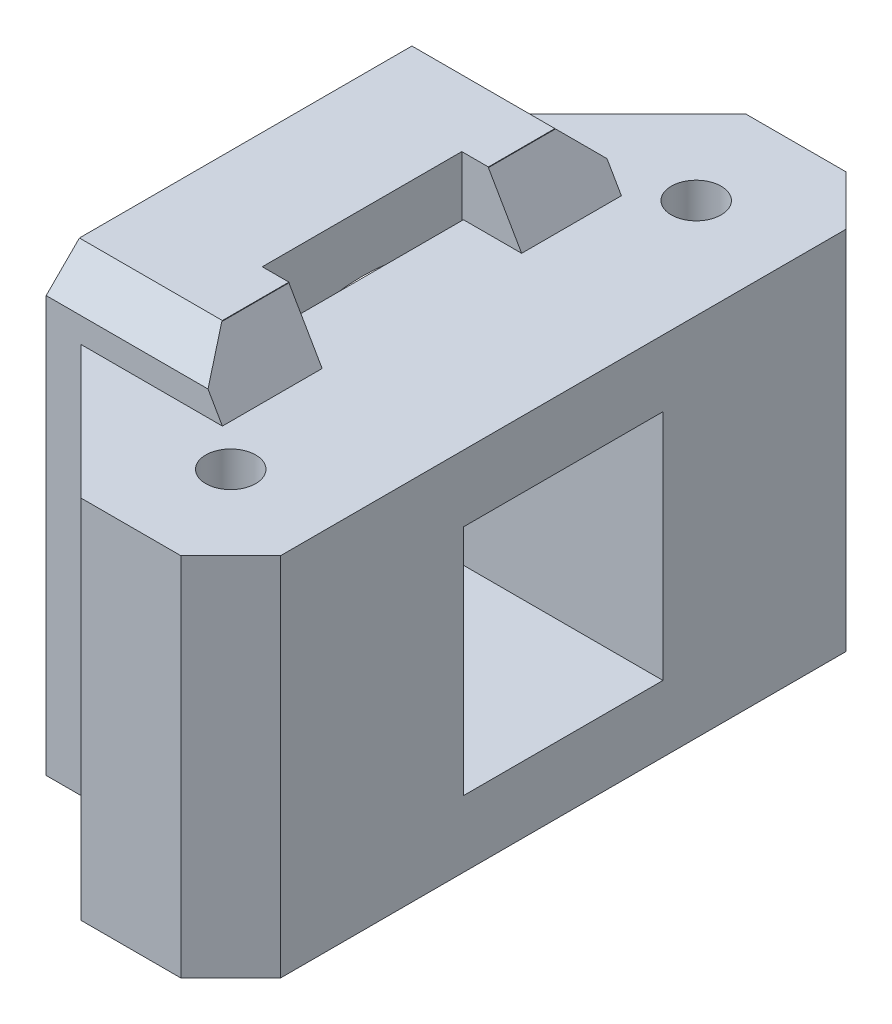
from build123d import *

# Parameters (mm, degrees)
SKETCH1_R                 = 1.5
BOSS_EXTRUDE1_DEPTH       = 3
BOSS_EXTRUDE2_START       = 22.5
SKETCH2_W                 = 1.6
SKETCH2_H                 = 6
BOSS_EXTRUDE2_DEPTH       = 29
SKETCH4_R                 = 1.5
BOSS_EXTRUDE5_DEPTH       = 1
CHAMFER2_SIZE             = 2
CHAMFER2_SIZE2            = 3.464101615
SKETCH3_W                 = 24
SKETCH3_H                 = 29
SKETCH3_R                 = 11
BOSS_EXTRUDE4_DEPTH       = 7
CHAMFER3_SIZE             = 2
CHAMFER2_OF_MIRROR1_SIZE2 = 2
CHAMFER2_OF_MIRROR1_SIZE  = 3.464101615
SKETCH5_R                 = 2
BOSS_EXTRUDE6_DEPTH       = 14
CHAMFER5_SIZE             = 5


with BuildPart() as part:
    # Sketch1 → Boss-Extrude1 (new body)
    with BuildSketch(Plane(origin=(0, 0, 0), x_dir=(1, 0, 0), z_dir=(0, 1, 0))):
        Polygon((-6, 17), (-3, 20), (3, 20), (6, 17), (6, -17), (3, -20), (-3, -20), (-6, -17), align=None)
        with Locations(Location((0, 14, 0), (0, 0, 270))):
            Circle(SKETCH1_R, mode=Mode.SUBTRACT)
        with Locations(Location((0, -14, 0), (0, 0, 270))):
            Circle(SKETCH1_R, mode=Mode.SUBTRACT)
    boss_extrude1 = extrude(amount=BOSS_EXTRUDE1_DEPTH)

    # Sketch2 → Boss-Extrude2 (add)
    with BuildSketch(Plane(origin=(0, 3, 0), x_dir=(1, 0, 0), z_dir=(0, 1, 0)).offset(BOSS_EXTRUDE2_START)):
        with Locations((-5.3, 9)):
            Rectangle(SKETCH2_W, SKETCH2_H)
        with Locations((-5.3, -9)):
            Rectangle(SKETCH2_W, SKETCH2_H)
    extrude(amount=-BOSS_EXTRUDE2_DEPTH)

    # Sketch4 → Boss-Extrude5 (add)
    with BuildSketch(Plane(origin=(0, 3, 0), x_dir=(1, 0, 0), z_dir=(0, 1, 0))):
        Polygon((-3, 20), (-6, 17), (-6, 12), (-4.5, 12), (-4.5, 6), (-6, 6), (-6, -6), (-4.5, -6), (-4.5, -12), (-6, -12), (-6, -17), (-3, -20), (3, -20), (6, -17), (6, 17), (3, 20), align=None)
        with Locations(Location((0, 14, 0), (0, 0, 270))):
            Circle(SKETCH4_R, mode=Mode.SUBTRACT)
        with Locations(Location((0, -14, 0), (0, 0, 270))):
            Circle(SKETCH4_R, mode=Mode.SUBTRACT)
    boss_extrude5 = extrude(amount=BOSS_EXTRUDE5_DEPTH)

    # Chamfer2
    chamfer2_edges = [part.edges().sort_by_distance(p)[0] for p in [
        (-4.5, 0, 9),
        (-4.5, 0, -9),
    ]]
    chamfer2_side = [part.faces().sort_by_distance(p)[0] for p in [
        (0.219837568, 0, 0),
    ]]
    chamfer(chamfer2_edges, length=CHAMFER2_SIZE, length2=CHAMFER2_SIZE2, reference=chamfer2_side[0])

    # Sketch3 → Boss-Extrude4 (add)
    with BuildSketch(Plane.ZY.offset(6.1)):
        with Locations((0, 11)):
            Rectangle(SKETCH3_W, SKETCH3_H)
        with Locations(Location((0, 11, 0), (0, 0, 236.944268849))):
            Circle(SKETCH3_R, mode=Mode.SUBTRACT)
    extrude(amount=BOSS_EXTRUDE4_DEPTH)

    # Chamfer3
    chamfer3_edges = [part.edges().sort_by_distance(p)[0] for p in [
        (-8.8, 25.5, -12),
        (-8.8, -3.5, -12),
        (-8.8, -3.5, 12),
        (-8.8, 25.5, 12),
    ]]
    chamfer(chamfer3_edges, length=CHAMFER3_SIZE)

    # Mirror1: Boss-Extrude1, Boss-Extrude5 across plane
    add(boss_extrude1.mirror(Plane(origin=(0, 11, 0), x_dir=(0, 0, 1), z_dir=(0, -1, 0))))
    add(boss_extrude5.mirror(Plane(origin=(0, 11, 0), x_dir=(0, 0, 1), z_dir=(0, -1, 0))))

    # Chamfer2 of Mirror1
    chamfer2_of_mirror1_edges = [part.edges().sort_by_distance(p)[0] for p in [
        (-4.5, 22, 9),
        (-4.5, 22, -9),
    ]]
    chamfer(chamfer2_of_mirror1_edges, length=CHAMFER2_OF_MIRROR1_SIZE, length2=CHAMFER2_OF_MIRROR1_SIZE2)

    # Sketch5 → Boss-Extrude6 (add)
    # profile 1 of 2: a face of its own
    with BuildSketch(Plane(origin=(0, 4, 0), x_dir=(1, 0, 0), z_dir=(0, 1, 0))):
        Polygon((6, -6), (-6, -6), (-6, -17), (-3, -20), (3, -20), (6, -17), align=None)
        with Locations(Location((0, -14, 0), (0, 0, 90))):
            Circle(SKETCH5_R, mode=Mode.SUBTRACT)
    # profile 2 of 2: a face of its own
    with BuildSketch(Plane(origin=(0, 4, 0), x_dir=(1, 0, 0), z_dir=(0, 1, 0))):
        Polygon((-6, 17), (-6, 6), (6, 6), (6, 17), (3, 20), (-3, 20), align=None)
        with Locations(Location((0, 14, 0), (0, 0, 90))):
            Circle(SKETCH5_R, mode=Mode.SUBTRACT)
    extrude(amount=BOSS_EXTRUDE6_DEPTH)

    # Chamfer5
    chamfer5_edges = [part.edges().sort_by_distance(p)[0] for p in [
        (-6, 11, 12),
        (-6, 11, -12),
    ]]
    chamfer(chamfer5_edges, length=CHAMFER5_SIZE - 0.0001)  # a hair under: the kernel refuses the full size


solid = part.part
